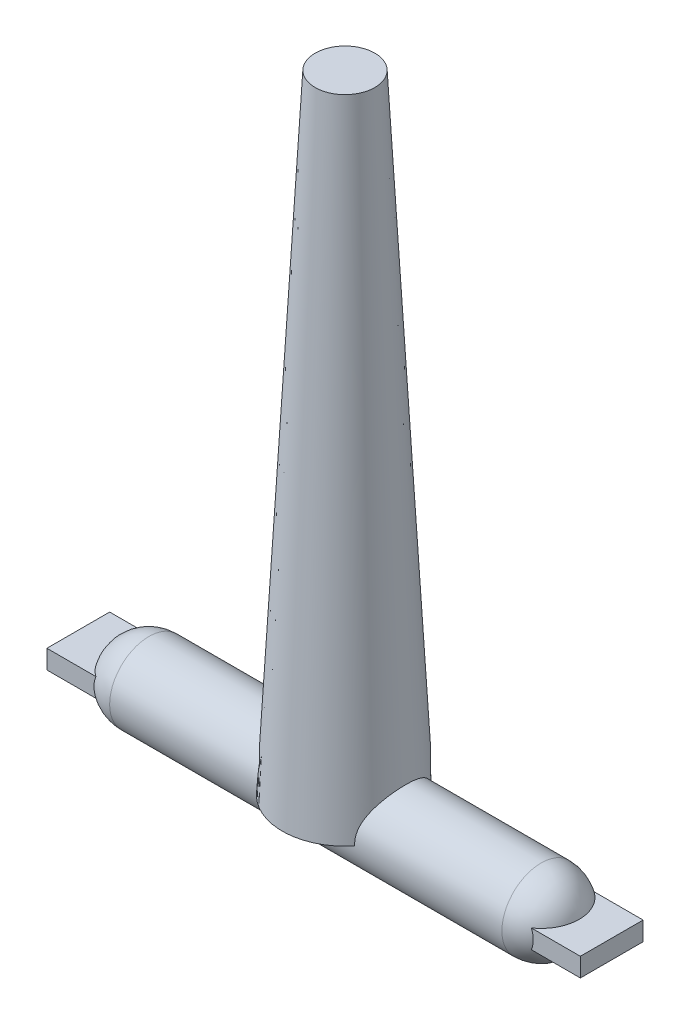
from build123d import *

# Parameters (mm, degrees)
SKETCH3_R           = 3.175
BOSS_EXTRUDE1_DEPTH = 19.05
FILLET1_R           = 3.175
SKETCH4_W           = 5.08
SKETCH4_H           = 1.524
BOSS_EXTRUDE2_DEPTH = 21.59


with BuildPart() as part:
    # Sketch1 → Revolve1 (revolve)
    with BuildSketch(Plane.XY):
        Polygon((0, 50.8), (0, 0), (5.075315188, 0), (2.413, 50.8), align=None)
    revolve(axis=Axis((0, 50.8, 0), (0, -1, 0)))

    # Sketch3 → Boss-Extrude1 (add, symmetric)
    with BuildSketch(Plane(origin=(0, 0, 0), x_dir=(0, 0, -1), z_dir=(1, 0, 0))):
        Circle(SKETCH3_R)
    extrude(amount=BOSS_EXTRUDE1_DEPTH, both=True)

    # Fillet1
    fillet1_edges = [part.edges().sort_by_distance(p)[0] for p in [
        (-19.05, 0, 3.175),
        (19.05, 0, 3.175),
    ]]
    fillet(fillet1_edges, radius=FILLET1_R)

    # Sketch4 → Boss-Extrude2 (add, symmetric)
    with BuildSketch(Plane(origin=(0, 0, 0), x_dir=(0, 0, -1), z_dir=(1, 0, 0))):
        Rectangle(SKETCH4_W, SKETCH4_H)
    extrude(amount=BOSS_EXTRUDE2_DEPTH, both=True)


solid = part.part
